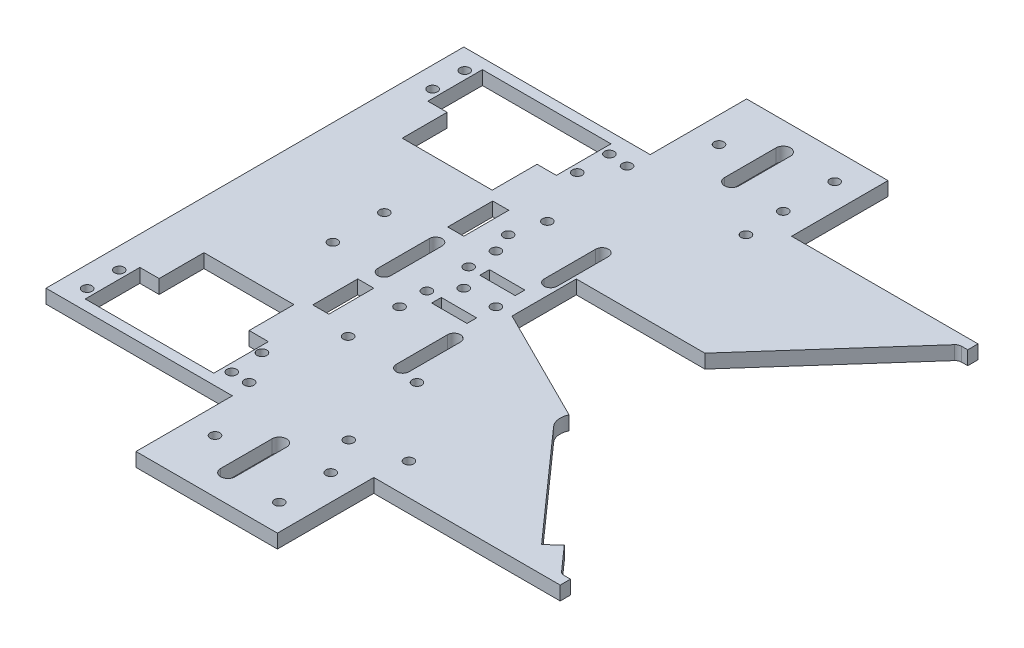
from build123d import *

# Parameters (mm, degrees)
BOSS_EXTRUDE1_DEPTH = 4.3
CUT_EXTRUDE1_DEPTH  = 4.5
FILLET1_R           = 2
CUT_EXTRUDE2_DEPTH  = 10
SKETCH8_R           = 1.5
CUT_EXTRUDE3_DEPTH  = 10
SKETCH9_R           = 1.5
CUT_EXTRUDE4_DEPTH  = 10
CUT_EXTRUDE5_DEPTH  = 10
SKETCH11_R          = 1.5
CUT_EXTRUDE6_DEPTH  = 10
SKETCH12_R          = 1.5
CUT_EXTRUDE7_DEPTH  = 10
SKETCH7_R           = 1.5
SKETCH7_W           = 11
SKETCH7_H           = 3
CUT_EXTRUDE8_DEPTH  = 9
SKETCH13_R          = 1.5
CUT_EXTRUDE9_DEPTH  = 10
SKETCH14_R          = 1.5
CUT_EXTRUDE10_DEPTH = 10
SKETCH15_W          = 5
SKETCH15_H          = 14
CUT_EXTRUDE11_DEPTH = 10
SKETCH16_R          = 1.5
CUT_EXTRUDE12_DEPTH = 10


with BuildPart() as part:
    # Sketch2 → Boss-Extrude1 (new body)
    with BuildSketch(Plane(origin=(0, 0, 0), x_dir=(1, 0, 0), z_dir=(0, 1, 0))):
        Polygon((0, 0), (0, 65), (58, 65), (58, 95), (102, 95), (102, 65), (160, 65), (160, 0), align=None)
    extrude(amount=BOSS_EXTRUDE1_DEPTH)

    # Mirror1: part across plane


with BuildPart() as part_1:
    add(part.part)
    add(part.part.mirror(Plane(origin=(0, 4.3, 0), x_dir=(1, 0, 0), z_dir=(0, 0, -1))))

    # Sketch3 → Cut-Extrude1 (cut)
    with BuildSketch(Plane(origin=(0, 4.3, 0), x_dir=(1, 0, 0), z_dir=(0, 1, 0))):
        Polygon((160, -61.8), (160, 61.8), (157.156451185, 61.8), (120.012594795, 20), (80.012594795, 20), (80.012594795, 0), (120, -20), (157.155555556, -61.8), align=None)
    extrude(amount=-CUT_EXTRUDE1_DEPTH, mode=Mode.SUBTRACT)

    # Fillet1
    fillet1_edges = [part_1.edges().sort_by_distance(p)[0] for p in [
        (157.156451185, 2.15, -61.8),
        (157.155555556, 2.15, 61.8),
    ]]
    fillet(fillet1_edges, radius=FILLET1_R)

    # Sketch6 → Cut-Extrude2 (cut)
    with BuildSketch(Plane(origin=(0, 4.3, 0), x_dir=(1, 0, 0), z_dir=(0, 1, 0))):
        Polygon((9, -61.8), (49, -61.8), (49, -44.8), (43, -44.8), (43, -30.841820122), (15, -30.841820122), (15, -44.8), (9, -44.8), align=None)
        Polygon((9, 44.8), (15, 44.8), (15, 30.841820122), (43, 30.841820122), (43, 44.8), (49, 44.8), (49, 61.8), (9, 61.8), align=None)
    extrude(amount=-CUT_EXTRUDE2_DEPTH, mode=Mode.SUBTRACT)

    # Sketch8 → Cut-Extrude3 (cut)
    with BuildSketch(Plane(origin=(0, 4.3, 0), x_dir=(1, 0, 0), z_dir=(0, 1, 0))):
        with Locations((6.5, 58.8)):
            Circle(SKETCH8_R)
        with Locations((6.5, 48.8)):
            Circle(SKETCH8_R)
        with Locations((51.5, 48.8)):
            Circle(SKETCH8_R)
        with Locations((51.5, 58.8)):
            Circle(SKETCH8_R)
        with Locations((6.5, -48.7)):
            Circle(SKETCH8_R)
        with Locations((6.5, -58.7)):
            Circle(SKETCH8_R)
        with Locations((51.5, -58.7)):
            Circle(SKETCH8_R)
        with Locations((51, -48.8)):
            Circle(SKETCH8_R)
    extrude(amount=-CUT_EXTRUDE3_DEPTH, mode=Mode.SUBTRACT)

    # Sketch9 → Cut-Extrude4 (cut)
    with BuildSketch(Plane.XZ):
        with Locations((94, 70.4)):
            Circle(SKETCH9_R)
        with Locations((66, 78.4)):
            Circle(SKETCH9_R)
        with Locations((66, -78.4)):
            Circle(SKETCH9_R)
        with Locations((94, -86.4)):
            Circle(SKETCH9_R)
        with Locations((94, 86.4)):
            Circle(SKETCH9_R)
        with Locations((94, -70.4)):
            Circle(SKETCH9_R)
        with BuildLine():
            Line((75.75, 70.4), (75.75, 86.4))
            ThreePointArc((75.75, 86.4), (78, 88.65), (80.25, 86.4))
            Line((80.25, 86.4), (80.25, 70.4))
            ThreePointArc((80.25, 70.4), (78, 68.15), (75.75, 70.4))
        make_face()
        with BuildLine():
            Line((75.75, -86.4), (75.75, -70.4))
            ThreePointArc((75.75, -70.4), (78, -68.15), (80.25, -70.4))
            Line((80.25, -70.4), (80.25, -86.4))
            ThreePointArc((80.25, -86.4), (78, -88.65), (75.75, -86.4))
        make_face()
    extrude(amount=-CUT_EXTRUDE4_DEPTH, mode=Mode.SUBTRACT)

    # Sketch10 → Cut-Extrude5 (cut)
    with BuildSketch(Plane(origin=(0, 4.3, 0), x_dir=(1, 0, 0), z_dir=(0, 1, 0))):
        with BuildLine():
            Line((123.321819194, -23.737046593), (149.896372747, -53.633419341))
            Line((149.896372747, -53.633419341), (146.159326154, -56.955238535))
            Line((146.159326154, -56.955238535), (116.262953407, -23.321819194))
            ThreePointArc((116.262953407, -23.321819194), (120.29361011, -15.008628134), (123.321819194, -23.737046593))
        make_face()
    extrude(amount=-CUT_EXTRUDE5_DEPTH, mode=Mode.SUBTRACT)

    # Sketch11 → Cut-Extrude6 (cut)
    with BuildSketch(Plane.XZ):
        with BuildLine():
            ThreePointArc((79, 31.031280577), (77, 33.031280577), (75, 31.031280577))
            Line((75, 31.031280577), (75, 15.031280577))
            ThreePointArc((75, 15.031280577), (77, 13.031280577), (79, 15.031280577))
            Line((79, 15.031280577), (79, 31.031280577))
        make_face()
        with BuildLine():
            ThreePointArc((75, -31.031280577), (77, -33.031280577), (79, -31.031280577))
            Line((79, -31.031280577), (79, -15.031280577))
            ThreePointArc((79, -15.031280577), (77, -13.031280577), (75, -15.031280577))
            Line((75, -15.031280577), (75, -31.031280577))
        make_face()
        with Locations((60, 31)):
            Circle(SKETCH11_R)
        with Locations((60, 15)):
            Circle(SKETCH11_R)
        with Locations((60, -15)):
            Circle(SKETCH11_R)
        with Locations((60, -31)):
            Circle(SKETCH11_R)
    extrude(amount=-CUT_EXTRUDE6_DEPTH, mode=Mode.SUBTRACT)

    # Sketch12 → Cut-Extrude7 (cut)
    with BuildSketch(Plane(origin=(0, 0, 0), x_dir=(-1, 0, 0), z_dir=(0, -1, 0))):
        with BuildLine():
            ThreePointArc((-50.262723036, -8), (-48.262723036, -10), (-46.262723036, -8))
            Line((-46.262723036, -8), (-46.262723036, 8))
            ThreePointArc((-46.262723036, 8), (-48.262723036, 10), (-50.262723036, 8))
            Line((-50.262723036, 8), (-50.262723036, -8))
        make_face()
        with Locations((-32.262723036, -8)):
            Circle(SKETCH12_R)
        with Locations((-32.262723036, 8)):
            Circle(SKETCH12_R)
    extrude(amount=-CUT_EXTRUDE7_DEPTH, mode=Mode.SUBTRACT)

    # Sketch7 → Cut-Extrude8 (cut)
    with BuildSketch(Plane(origin=(0, 4.3, 0), x_dir=(1, 0, 0), z_dir=(0, 1, 0))):
        with Locations((60.012594795, -6.5)):
            Circle(SKETCH7_R)
        with Locations((60.012594795, 6.5)):
            Circle(SKETCH7_R)
        with Locations((69.5, -7.5)):
            Rectangle(SKETCH7_W, SKETCH7_H)
        with Locations((69.5, 7.5)):
            Rectangle(SKETCH7_W, SKETCH7_H)
    extrude(amount=-CUT_EXTRUDE8_DEPTH, mode=Mode.SUBTRACT)

    # Sketch13 → Cut-Extrude9 (cut)
    with BuildSketch(Plane(origin=(0, 4.3, 0), x_dir=(1, 0, 0), z_dir=(0, 1, 0))):
        with Locations((75, 0)):
            Circle(SKETCH13_R)
        with Locations((65, 0)):
            Circle(SKETCH13_R)
    extrude(amount=-CUT_EXTRUDE9_DEPTH, mode=Mode.SUBTRACT)

    # Sketch14 → Cut-Extrude10 (cut)
    with BuildSketch(Plane(origin=(0, 4.3, 0), x_dir=(1, 0, 0), z_dir=(0, 1, 0))):
        with Locations((57.5, 58.3)):
            Circle(SKETCH14_R)
        with Locations((94.5, 58.3)):
            Circle(SKETCH14_R)
        with Locations((57.5, 21.3)):
            Circle(SKETCH14_R)
        with Locations((83.127806945, -32.705958418)):
            Circle(SKETCH14_R)
        with Locations((103.05872211, -55.128237978)):
            Circle(SKETCH14_R)
    extrude(amount=-CUT_EXTRUDE10_DEPTH, mode=Mode.SUBTRACT)

    # Sketch15 → Cut-Extrude11 (cut)
    with BuildSketch(Plane(origin=(0, 4.3, 0), x_dir=(1, 0, 0), z_dir=(0, 1, 0))):
        with Locations((48.5, 21)):
            Rectangle(SKETCH15_W, SKETCH15_H)
        with Locations((48.5, -21)):
            Rectangle(SKETCH15_W, SKETCH15_H)
    extrude(amount=-CUT_EXTRUDE11_DEPTH, mode=Mode.SUBTRACT)

    # Sketch16 → Cut-Extrude12 (cut)
    with BuildSketch(Plane(origin=(0, 4.3, 0), x_dir=(1, 0, 0), z_dir=(0, 1, 0))):
        with Locations((88, -58.8)):
            Circle(SKETCH16_R)
        with Locations((57, -58.8)):
            Circle(SKETCH16_R)
    extrude(amount=-CUT_EXTRUDE12_DEPTH, mode=Mode.SUBTRACT)


solid = part_1.part
